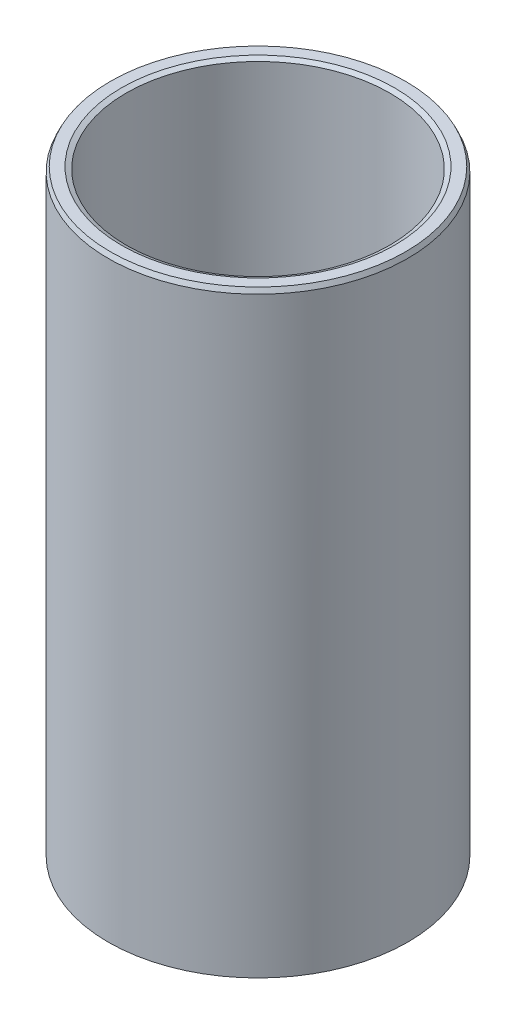
from build123d import *
from OCP.BRepFilletAPI import BRepFilletAPI_MakeChamfer

# Parameters (mm, degrees)
SKETCH1_R           = 60
BOSS_EXTRUDE1_DEPTH = 239.882895697
SKETCH2_R           = 52.783737849
CUT_EXTRUDE1_DEPTH  = 255.448037225
CHAMFER1_SIZE       = 1.872174067
CHAMFER1_SIZE2      = 0.880226061


with BuildPart() as part:
    # Sketch1 → Boss-Extrude1 (new body)
    with BuildSketch(Plane(origin=(0, 0, 0), x_dir=(1, 0, 0), z_dir=(0, 1, 0))):
        Circle(SKETCH1_R)
    extrude(amount=BOSS_EXTRUDE1_DEPTH)

    # Sketch2 → Cut-Extrude1 (cut, through all)
    with BuildSketch(Plane(origin=(0, 0, 0), x_dir=(1, 0, 0), z_dir=(0, 1, 0))):
        Circle(SKETCH2_R)
    extrude(amount=CUT_EXTRUDE1_DEPTH, mode=Mode.SUBTRACT)

    # Chamfer1: one chamfer whose edges measure the first distance from different faces: ONE call of the kernel's chamfer builder (chamfer() names one face for all edges)
    chamfer1_edges_1 = [part.edges().sort_by_distance(p)[0] for p in [
        (-52.783737849, 239.882895697, 0),
    ]]
    chamfer1_side_1 = [part.faces().sort_by_distance(p)[0] for p in [
        (-58.302943725, 239.882895697, 0),
    ]]
    chamfer1_edges_2 = [part.edges().sort_by_distance(p)[0] for p in [
        (-52.783737849, 0, 0),
    ]]
    chamfer1_side_2 = [part.faces().sort_by_distance(p)[0] for p in [
        (-52.783737849, 119.941447848, 0),
    ]]
    chamfer1_edges_3 = [part.edges().sort_by_distance(p)[0] for p in [
        (-60, 0, 0),
    ]]
    chamfer1_side_3 = [part.faces().sort_by_distance(p)[0] for p in [
        (-58.302943725, 0, 0),
    ]]
    chamfer1_edges_4 = [part.edges().sort_by_distance(p)[0] for p in [
        (-60, 239.882895697, 0),
    ]]
    chamfer1_side_4 = [part.faces().sort_by_distance(p)[0] for p in [
        (-60, 119.941447848, 0),
    ]]
    chamfer1 = BRepFilletAPI_MakeChamfer(part.part.solid().wrapped)
    for e in chamfer1_edges_1:
        chamfer1.Add(CHAMFER1_SIZE, CHAMFER1_SIZE2, e.wrapped, chamfer1_side_1[0].wrapped)  # the first distance lies on this face
    for e in chamfer1_edges_2:
        chamfer1.Add(CHAMFER1_SIZE, CHAMFER1_SIZE2, e.wrapped, chamfer1_side_2[0].wrapped)  # the first distance lies on this face
    for e in chamfer1_edges_3:
        chamfer1.Add(CHAMFER1_SIZE, CHAMFER1_SIZE2, e.wrapped, chamfer1_side_3[0].wrapped)  # the first distance lies on this face
    for e in chamfer1_edges_4:
        chamfer1.Add(CHAMFER1_SIZE, CHAMFER1_SIZE2, e.wrapped, chamfer1_side_4[0].wrapped)  # the first distance lies on this face
    add(Compound.cast(chamfer1.Shape()), mode=Mode.REPLACE)


solid = part.part
